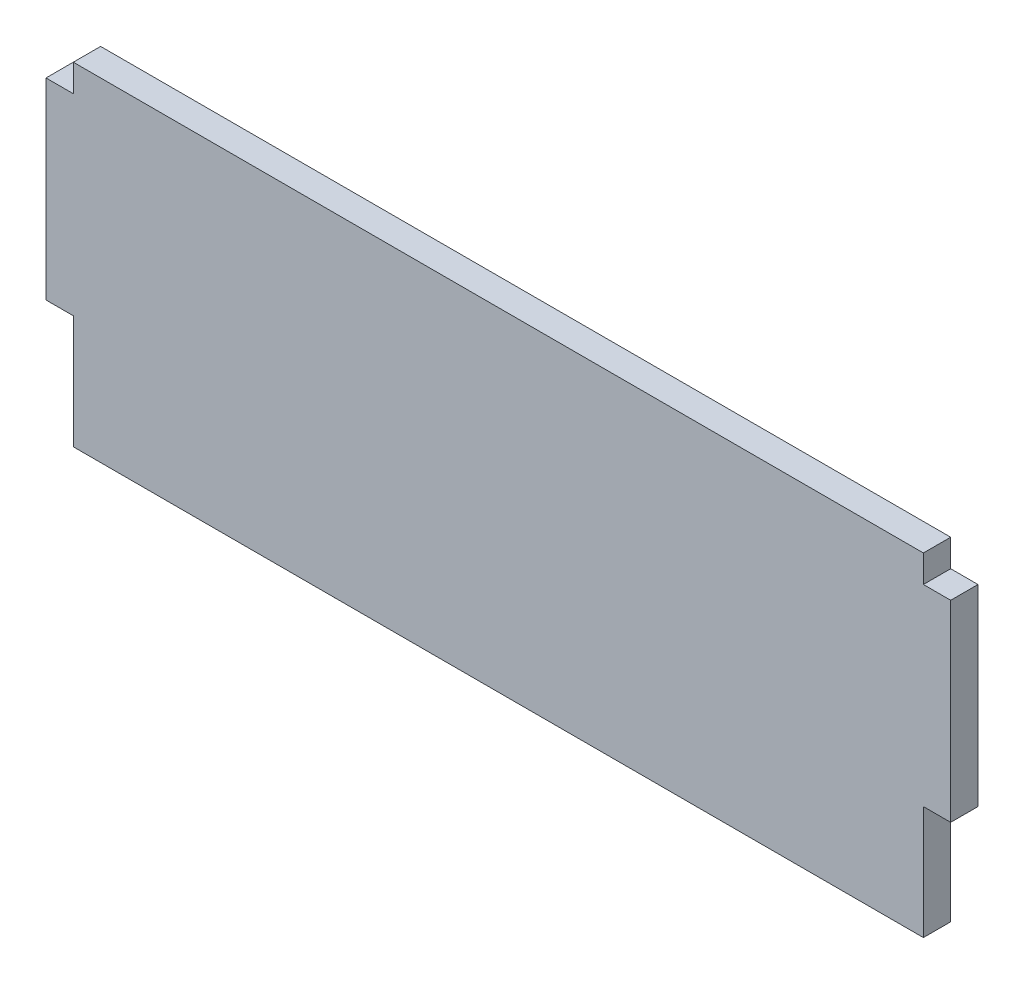
from build123d import *

# Parameters (mm, degrees)
BOSS_EXTRUDE1_DEPTH = 1.8034


with BuildPart() as part:
    # Sketch1 → Boss-Extrude1 (new body)
    with BuildSketch(Plane.XY):
        Polygon((1.8034, 84.963), (0, 84.963), (0, 86.7664), (-56.134, 86.7664), (-56.134, 84.963), (-57.9374, 84.963), (-57.9374, 72.263), (-56.134, 72.263), (-56.134, 64.77), (0, 64.77), (0, 72.263), (1.8034, 72.263), align=None)
    extrude(amount=BOSS_EXTRUDE1_DEPTH)


solid = part.part
